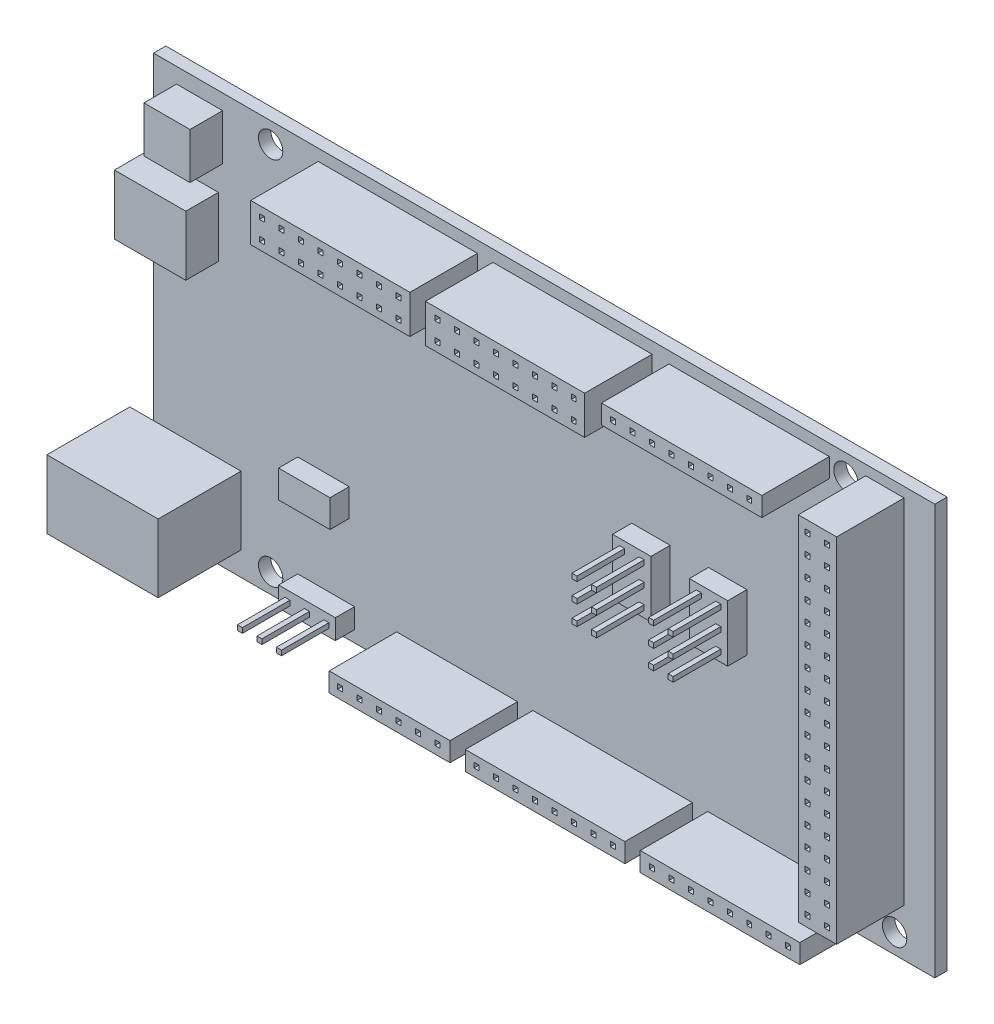
from build123d import *

# Parameters (mm, degrees)
SKETCH2_W                    = 101.85
SKETCH2_H                    = 53.5
SKETCH2_R                    = 1.5875
BASE_BOARD_DEPTH             = 1.6
SKETCH3_W                    = 20.75
SKETCH3_H                    = 5
SKETCH3_W_2                  = 20.9
SKETCH3_H_2                  = 2.5
SKETCH3_W_3                  = 5
SKETCH3_H_3                  = 46
SKETCH3_W_4                  = 15.75
SKETCH3_W_5                  = 20.8
HEADERS_DEPTH                = 8.8
SKETCH4_W                    = 5
SKETCH4_H                    = 7.4
SKETCH4_W_2                  = 7.4
SKETCH4_H_2                  = 2.6
SKETCH4_W_3                  = 6.7
SKETCH4_H_3                  = 3.6
PINBASE_DEPTH                = 2.5
PINS_DEPTH                   = 8.7
PINS_DEPTH_BACK              = 3.2
SKETCH5_W                    = 0.65
SKETCH5_H                    = 0.65
SKETCH6_W                    = 6
SKETCH6_H                    = 6
SKETCH6_W_2                  = 9.3
SKETCH6_H_2                  = 7.8
USBMINI_BUTTON_DEPTH         = 4.25
SKETCH8_W                    = 14.5
SKETCH8_H                    = 8.9
POWER_DEPTH                  = 10.8
SKETCH9_W                    = 3
SKETCH9_H                    = 0.9
SKETCH9_W_2                  = 0.9
SKETCH9_H_2                  = 3
UNDERSIDE_SOLDER_TAILS_DEPTH = 1.8
SKETCH10_W                   = 0.65
SKETCH10_H                   = 0.65
UNDERSIDE_RAIL_TAILS_DEPTH   = 1.6
LPATTERN1_COUNT              = 2
LPATTERN1_PITCH              = 2.54
LPATTERN1_COUNT_DIR2         = 18
LPATTERN1_PITCH_DIR2         = 2.54
SKETCH11_W                   = 0.65
SKETCH11_H                   = 0.65
BOSS_EXTRUDE9_DEPTH          = 1.6
LPATTERN2_COUNT              = 8
LPATTERN2_PITCH              = 2.54
SKETCH12_W                   = 0.65
SKETCH12_H                   = 0.65
BOSS_EXTRUDE10_DEPTH         = 1.6
LPATTERN3_COUNT              = 15
LPATTERN3_PITCH              = 2.54
SKETCH13_W                   = 0.65
SKETCH13_H                   = 0.65
BOSS_EXTRUDE11_DEPTH         = 1.6
LPATTERN4_COUNT              = 17
LPATTERN4_PITCH              = 2.54
LPATTERN4_COUNT_DIR2         = 2
LPATTERN4_PITCH_DIR2         = 2.54
SKETCH15_W                   = 0.65
SKETCH15_H                   = 0.65
CUT_EXTRUDE1_DEPTH           = 5


with BuildPart() as part:
    # Sketch2 → base board (new body)
    with BuildSketch(Plane.XY):
        Rectangle(SKETCH2_W, SKETCH2_H)
        with Locations((45.6875, -24.1875)):
            Circle(SKETCH2_R, mode=Mode.SUBTRACT)
        with Locations((-35.6625, -24.1875)):
            Circle(SKETCH2_R, mode=Mode.SUBTRACT)
        with Locations((39.3375, 24.0625)):
            Circle(SKETCH2_R, mode=Mode.SUBTRACT)
        with Locations((-35.6625, 24.0625)):
            Circle(SKETCH2_R, mode=Mode.SUBTRACT)
    extrude(amount=-BASE_BOARD_DEPTH)

    # Sketch3 → headers (add)
    with BuildSketch(Plane.XY):
        with Locations((-19.082, 22.75)):
            Rectangle(SKETCH3_W, SKETCH3_H)
        with Locations((3.7, 22.75)):
            Rectangle(SKETCH3_W, SKETCH3_H)
        with Locations((26.725, 24)):
            Rectangle(SKETCH3_W_2, SKETCH3_H_2)
        with Locations((44.425, 2.45)):
            Rectangle(SKETCH3_W_3, SKETCH3_H_3)
        with Locations((-11.35, -24)):
            Rectangle(SKETCH3_W_4, SKETCH3_H_2)
        with Locations((8.925, -24)):
            Rectangle(SKETCH3_W_5, SKETCH3_H_2)
        with Locations((31.725, -24)):
            Rectangle(SKETCH3_W_5, SKETCH3_H_2)
    extrude(amount=HEADERS_DEPTH)

    # Sketch4 → pinbase (add)
    with BuildSketch(Plane.XY):
        with Locations((13.925, 1.15)):
            Rectangle(SKETCH4_W, SKETCH4_H)
        with Locations((23.925, 1.15)):
            Rectangle(SKETCH4_W, SKETCH4_H)
        with Locations((-28.425, -23.95)):
            Rectangle(SKETCH4_W_2, SKETCH4_H_2)
        with Locations((-28.775, -11.25)):
            Rectangle(SKETCH4_W_3, SKETCH4_H_3)
    extrude(amount=PINBASE_DEPTH)

    # Sketch5 → pins (add, two sides: drawn at the far end of the back side and taken through both)
    with BuildSketch(Plane.XY.offset(-PINS_DEPTH_BACK)):
        with Locations((-30.965, -23.95)):
            Rectangle(SKETCH5_W, SKETCH5_H)
        with Locations((-25.885, -23.95)):
            Rectangle(SKETCH5_W, SKETCH5_H)
        with Locations((-28.425, -23.95)):
            Rectangle(SKETCH5_W, SKETCH5_H)
        with Locations((12.655, 3.69)):
            Rectangle(SKETCH5_W, SKETCH5_H)
        with Locations((15.195, 3.69)):
            Rectangle(SKETCH5_W, SKETCH5_H)
        with Locations((12.655, 1.15)):
            Rectangle(SKETCH5_W, SKETCH5_H)
        with Locations((15.195, 1.15)):
            Rectangle(SKETCH5_W, SKETCH5_H)
        with Locations((12.655, -1.39)):
            Rectangle(SKETCH5_W, SKETCH5_H)
        with Locations((15.195, -1.39)):
            Rectangle(SKETCH5_W, SKETCH5_H)
        with Locations((22.655, -1.39)):
            Rectangle(SKETCH5_W, SKETCH5_H)
        with Locations((22.655, 1.15)):
            Rectangle(SKETCH5_W, SKETCH5_H)
        with Locations((22.655, 3.69)):
            Rectangle(SKETCH5_W, SKETCH5_H)
        with Locations((25.195, -1.39)):
            Rectangle(SKETCH5_W, SKETCH5_H)
        with Locations((25.195, 1.15)):
            Rectangle(SKETCH5_W, SKETCH5_H)
        with Locations((25.195, 3.69)):
            Rectangle(SKETCH5_W, SKETCH5_H)
    extrude(amount=PINS_DEPTH + PINS_DEPTH_BACK)

    # Sketch6 → usbmini & button (add)
    with BuildSketch(Plane.XY):
        with Locations((-44.925, 21.75)):
            Rectangle(SKETCH6_W, SKETCH6_H)
        with Locations((-47.125, 11.35)):
            Rectangle(SKETCH6_W_2, SKETCH6_H_2)
    extrude(amount=USBMINI_BUTTON_DEPTH)

    # Sketch8 → power (add)
    with BuildSketch(Plane.XY):
        with Locations((-46.775, -19.2)):
            Rectangle(SKETCH8_W, SKETCH8_H)
    extrude(amount=POWER_DEPTH)

    # Sketch9 → underside solder tails (add)
    with BuildSketch(Plane(origin=(0, 0, -1.6), x_dir=(-1, 0, 0), z_dir=(0, 0, -1))):
        with Locations((43.675, -24.1)):
            Rectangle(SKETCH9_W, SKETCH9_H)
        with Locations((40.425, -19.15)):
            Rectangle(SKETCH9_W_2, SKETCH9_H_2)
        with Locations((46.925, -19.15)):
            Rectangle(SKETCH9_W_2, SKETCH9_H_2)
    extrude(amount=UNDERSIDE_SOLDER_TAILS_DEPTH)

    # Sketch10 → underside rail tails (add)
    with BuildSketch(Plane(origin=(0, 0, -1.6), x_dir=(-1, 0, 0), z_dir=(0, 0, -1))):
        with Locations((-45.695, 24)):
            Rectangle(SKETCH10_W, SKETCH10_H)
    underside_rail_tails = extrude(amount=UNDERSIDE_RAIL_TAILS_DEPTH)

    # LPattern1: underside rail tails 2 × 18
    with Locations(*[(-i * LPATTERN1_PITCH, -j * LPATTERN1_PITCH_DIR2, 0) for i in range(LPATTERN1_COUNT) for j in range(LPATTERN1_COUNT_DIR2) if (i, j) != (0, 0)]):
        add(underside_rail_tails)

    # Sketch11 → Boss-Extrude9 (add)
    with BuildSketch(Plane(origin=(0, 0, -1.6), x_dir=(-1, 0, 0), z_dir=(0, 0, -1))):
        with Locations((-35.535, 24)):
            Rectangle(SKETCH11_W, SKETCH11_H)
        with Locations((-40.615, -23.95)):
            Rectangle(SKETCH11_W, SKETCH11_H)
    boss_extrude9 = extrude(amount=BOSS_EXTRUDE9_DEPTH)

    # LPattern2: Boss-Extrude9 ×8
    with Locations(*[(-i * LPATTERN2_PITCH, 0, 0) for i in range(1, LPATTERN2_COUNT)]):
        add(boss_extrude9)

    # Sketch12 → Boss-Extrude10 (add)
    with BuildSketch(Plane(origin=(0, 0, -1.6), x_dir=(-1, 0, 0), z_dir=(0, 0, -1))):
        with Locations((-17.755, -23.95)):
            Rectangle(SKETCH12_W, SKETCH12_H)
    boss_extrude10 = extrude(amount=BOSS_EXTRUDE10_DEPTH)

    # LPattern3: Boss-Extrude10 ×15, 1 skipped
    with Locations(*[(-i * LPATTERN3_PITCH, 0, 0) for i in range(1, LPATTERN3_COUNT) if i not in (8,)]):
        add(boss_extrude10)

    # Sketch13 → Boss-Extrude11 (add)
    with BuildSketch(Plane(origin=(0, 0, -1.6), x_dir=(-1, 0, 0), z_dir=(0, 0, -1))):
        with Locations((-12.655, 24)):
            Rectangle(SKETCH13_W, SKETCH13_H)
    boss_extrude11 = extrude(amount=BOSS_EXTRUDE11_DEPTH)

    # LPattern4: Boss-Extrude11 17 × 2, 2 skipped
    with Locations(*[(-i * LPATTERN4_PITCH, -j * LPATTERN4_PITCH_DIR2, 0) for i in range(LPATTERN4_COUNT) for j in range(LPATTERN4_COUNT_DIR2) if (i, j) not in ((0, 0), (8, 0), (8, 1))]):
        add(boss_extrude11)

    # Sketch15 → Cut-Extrude1 (cut)
    with BuildSketch(Plane.XY.offset(8.8)):
        with Locations((45.695, 24)):
            Rectangle(SKETCH15_W, SKETCH15_H)
        with Locations((45.695, 21.46)):
            Rectangle(SKETCH15_W, SKETCH15_H)
        with Locations((45.695, 18.92)):
            Rectangle(SKETCH15_W, SKETCH15_H)
        with Locations((45.695, 16.38)):
            Rectangle(SKETCH15_W, SKETCH15_H)
        with Locations((45.695, 13.84)):
            Rectangle(SKETCH15_W, SKETCH15_H)
        with Locations((45.695, 11.3)):
            Rectangle(SKETCH15_W, SKETCH15_H)
        with Locations((45.695, 8.76)):
            Rectangle(SKETCH15_W, SKETCH15_H)
        with Locations((45.695, 6.22)):
            Rectangle(SKETCH15_W, SKETCH15_H)
        with Locations((45.695, 3.68)):
            Rectangle(SKETCH15_W, SKETCH15_H)
        with Locations((45.695, 1.14)):
            Rectangle(SKETCH15_W, SKETCH15_H)
        with Locations((45.695, -1.4)):
            Rectangle(SKETCH15_W, SKETCH15_H)
        with Locations((45.695, -3.94)):
            Rectangle(SKETCH15_W, SKETCH15_H)
        with Locations((45.695, -6.48)):
            Rectangle(SKETCH15_W, SKETCH15_H)
        with Locations((45.695, -9.02)):
            Rectangle(SKETCH15_W, SKETCH15_H)
        with Locations((45.695, -11.56)):
            Rectangle(SKETCH15_W, SKETCH15_H)
        with Locations((45.695, -14.1)):
            Rectangle(SKETCH15_W, SKETCH15_H)
        with Locations((45.695, -16.64)):
            Rectangle(SKETCH15_W, SKETCH15_H)
        with Locations((45.695, -19.18)):
            Rectangle(SKETCH15_W, SKETCH15_H)
        with Locations((43.155, 24)):
            Rectangle(SKETCH15_W, SKETCH15_H)
        with Locations((43.155, 21.46)):
            Rectangle(SKETCH15_W, SKETCH15_H)
        with Locations((43.155, 18.92)):
            Rectangle(SKETCH15_W, SKETCH15_H)
        with Locations((43.155, 16.38)):
            Rectangle(SKETCH15_W, SKETCH15_H)
        with Locations((43.155, 13.84)):
            Rectangle(SKETCH15_W, SKETCH15_H)
        with Locations((43.155, 11.3)):
            Rectangle(SKETCH15_W, SKETCH15_H)
        with Locations((43.155, 8.76)):
            Rectangle(SKETCH15_W, SKETCH15_H)
        with Locations((43.155, 6.22)):
            Rectangle(SKETCH15_W, SKETCH15_H)
        with Locations((43.155, 3.68)):
            Rectangle(SKETCH15_W, SKETCH15_H)
        with Locations((43.155, 1.14)):
            Rectangle(SKETCH15_W, SKETCH15_H)
        with Locations((43.155, -1.4)):
            Rectangle(SKETCH15_W, SKETCH15_H)
        with Locations((43.155, -3.94)):
            Rectangle(SKETCH15_W, SKETCH15_H)
        with Locations((43.155, -6.48)):
            Rectangle(SKETCH15_W, SKETCH15_H)
        with Locations((43.155, -9.02)):
            Rectangle(SKETCH15_W, SKETCH15_H)
        with Locations((43.155, -11.56)):
            Rectangle(SKETCH15_W, SKETCH15_H)
        with Locations((43.155, -14.1)):
            Rectangle(SKETCH15_W, SKETCH15_H)
        with Locations((43.155, -16.64)):
            Rectangle(SKETCH15_W, SKETCH15_H)
        with Locations((43.155, -19.18)):
            Rectangle(SKETCH15_W, SKETCH15_H)
        with Locations((35.535, 24)):
            Rectangle(SKETCH15_W, SKETCH15_H)
        with Locations((32.995, 24)):
            Rectangle(SKETCH15_W, SKETCH15_H)
        with Locations((30.455, 24)):
            Rectangle(SKETCH15_W, SKETCH15_H)
        with Locations((27.915, 24)):
            Rectangle(SKETCH15_W, SKETCH15_H)
        with Locations((25.375, 24)):
            Rectangle(SKETCH15_W, SKETCH15_H)
        with Locations((22.835, 24)):
            Rectangle(SKETCH15_W, SKETCH15_H)
        with Locations((20.295, 24)):
            Rectangle(SKETCH15_W, SKETCH15_H)
        with Locations((17.755, 24)):
            Rectangle(SKETCH15_W, SKETCH15_H)
        with Locations((12.655, 24)):
            Rectangle(SKETCH15_W, SKETCH15_H)
        with Locations((12.655, 21.46)):
            Rectangle(SKETCH15_W, SKETCH15_H)
        with Locations((10.115, 24)):
            Rectangle(SKETCH15_W, SKETCH15_H)
        with Locations((10.115, 21.46)):
            Rectangle(SKETCH15_W, SKETCH15_H)
        with Locations((7.575, 24)):
            Rectangle(SKETCH15_W, SKETCH15_H)
        with Locations((7.575, 21.46)):
            Rectangle(SKETCH15_W, SKETCH15_H)
        with Locations((5.035, 24)):
            Rectangle(SKETCH15_W, SKETCH15_H)
        with Locations((5.035, 21.46)):
            Rectangle(SKETCH15_W, SKETCH15_H)
        with Locations((2.495, 24)):
            Rectangle(SKETCH15_W, SKETCH15_H)
        with Locations((2.495, 21.46)):
            Rectangle(SKETCH15_W, SKETCH15_H)
        with Locations((-0.045, 24)):
            Rectangle(SKETCH15_W, SKETCH15_H)
        with Locations((-0.045, 21.46)):
            Rectangle(SKETCH15_W, SKETCH15_H)
        with Locations((-2.585, 24)):
            Rectangle(SKETCH15_W, SKETCH15_H)
        with Locations((-2.585, 21.46)):
            Rectangle(SKETCH15_W, SKETCH15_H)
        with Locations((-5.125, 24)):
            Rectangle(SKETCH15_W, SKETCH15_H)
        with Locations((-5.125, 21.46)):
            Rectangle(SKETCH15_W, SKETCH15_H)
        with Locations((-10.205, 24)):
            Rectangle(SKETCH15_W, SKETCH15_H)
        with Locations((-10.205, 21.46)):
            Rectangle(SKETCH15_W, SKETCH15_H)
        with Locations((-12.745, 24)):
            Rectangle(SKETCH15_W, SKETCH15_H)
        with Locations((-12.745, 21.46)):
            Rectangle(SKETCH15_W, SKETCH15_H)
        with Locations((-15.285, 24)):
            Rectangle(SKETCH15_W, SKETCH15_H)
        with Locations((-15.285, 21.46)):
            Rectangle(SKETCH15_W, SKETCH15_H)
        with Locations((-17.825, 24)):
            Rectangle(SKETCH15_W, SKETCH15_H)
        with Locations((-17.825, 21.46)):
            Rectangle(SKETCH15_W, SKETCH15_H)
        with Locations((-20.365, 24)):
            Rectangle(SKETCH15_W, SKETCH15_H)
        with Locations((-20.365, 21.46)):
            Rectangle(SKETCH15_W, SKETCH15_H)
        with Locations((-22.905, 24)):
            Rectangle(SKETCH15_W, SKETCH15_H)
        with Locations((-22.905, 21.46)):
            Rectangle(SKETCH15_W, SKETCH15_H)
        with Locations((-25.445, 24)):
            Rectangle(SKETCH15_W, SKETCH15_H)
        with Locations((-25.445, 21.46)):
            Rectangle(SKETCH15_W, SKETCH15_H)
        with Locations((-27.985, 24)):
            Rectangle(SKETCH15_W, SKETCH15_H)
        with Locations((-27.985, 21.46)):
            Rectangle(SKETCH15_W, SKETCH15_H)
        with Locations((40.615, -23.95)):
            Rectangle(SKETCH15_W, SKETCH15_H)
        with Locations((38.075, -23.95)):
            Rectangle(SKETCH15_W, SKETCH15_H)
        with Locations((35.535, -23.95)):
            Rectangle(SKETCH15_W, SKETCH15_H)
        with Locations((32.995, -23.95)):
            Rectangle(SKETCH15_W, SKETCH15_H)
        with Locations((30.455, -23.95)):
            Rectangle(SKETCH15_W, SKETCH15_H)
        with Locations((27.915, -23.95)):
            Rectangle(SKETCH15_W, SKETCH15_H)
        with Locations((25.375, -23.95)):
            Rectangle(SKETCH15_W, SKETCH15_H)
        with Locations((22.835, -23.95)):
            Rectangle(SKETCH15_W, SKETCH15_H)
        with Locations((17.755, -23.95)):
            Rectangle(SKETCH15_W, SKETCH15_H)
        with Locations((15.215, -23.95)):
            Rectangle(SKETCH15_W, SKETCH15_H)
        with Locations((12.675, -23.95)):
            Rectangle(SKETCH15_W, SKETCH15_H)
        with Locations((10.135, -23.95)):
            Rectangle(SKETCH15_W, SKETCH15_H)
        with Locations((7.595, -23.95)):
            Rectangle(SKETCH15_W, SKETCH15_H)
        with Locations((5.055, -23.95)):
            Rectangle(SKETCH15_W, SKETCH15_H)
        with Locations((2.515, -23.95)):
            Rectangle(SKETCH15_W, SKETCH15_H)
        with Locations((-0.025, -23.95)):
            Rectangle(SKETCH15_W, SKETCH15_H)
        with Locations((-5.105, -23.95)):
            Rectangle(SKETCH15_W, SKETCH15_H)
        with Locations((-7.645, -23.95)):
            Rectangle(SKETCH15_W, SKETCH15_H)
        with Locations((-10.185, -23.95)):
            Rectangle(SKETCH15_W, SKETCH15_H)
        with Locations((-12.725, -23.95)):
            Rectangle(SKETCH15_W, SKETCH15_H)
        with Locations((-15.265, -23.95)):
            Rectangle(SKETCH15_W, SKETCH15_H)
        with Locations((-17.805, -23.95)):
            Rectangle(SKETCH15_W, SKETCH15_H)
    extrude(amount=-CUT_EXTRUDE1_DEPTH, mode=Mode.SUBTRACT)


solid = part.part
